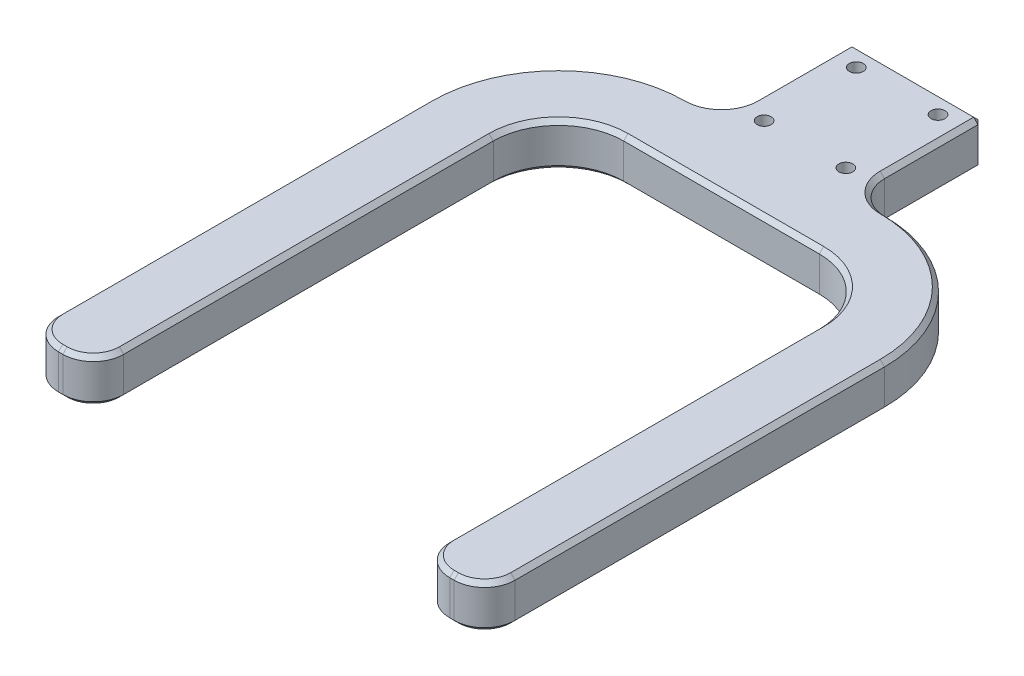
from build123d import *

# Parameters (mm, degrees)
SKETCH1_R           = 1.6
BOSS_EXTRUDE1_DEPTH = 10
FILLET1_R           = 7.5
CHAMFER1_SIZE       = 1


with BuildPart() as part:
    # Sketch1 → Boss-Extrude1 (new body)
    with BuildSketch(Plane(origin=(0, 0, 0), x_dir=(1, 0, 0), z_dir=(0, 1, 0))):
        with BuildLine():
            Line((22.5, 57.5), (0, 57.5))
            Line((0, 57.5), (0, 102.5))
            Line((0, 102.5), (15, 102.5))
            Line((15, 102.5), (15, 72.5))
            Line((15, 72.5), (22.5, 72.5))
            ThreePointArc((22.5, 72.5), (43.713203436, 63.713203436), (52.5, 42.5))
            Line((52.5, 42.5), (52.5, -42.5))
            ThreePointArc((52.5, -42.5), (50.449747468, -47.449747468), (45.5, -49.5))
            Line((45.5, -49.5), (44.5, -49.5))
            ThreePointArc((44.5, -49.5), (39.550252532, -47.449747468), (37.5, -42.5))
            Line((37.5, -42.5), (37.5, 42.5))
            ThreePointArc((37.5, 42.5), (33.106601718, 53.106601718), (22.5, 57.5))
        make_face()
        with Locations(Location((9.4, 97.9, 0), (0, 0, 270))):
            Circle(SKETCH1_R, mode=Mode.SUBTRACT)
        with Locations(Location((9.4, 76.7, 0), (0, 0, 270))):
            Circle(SKETCH1_R, mode=Mode.SUBTRACT)
    extrude(amount=BOSS_EXTRUDE1_DEPTH)

    # Fillet1
    fillet1_edges = [part.edges().sort_by_distance(p)[0] for p in [
        (15, 5, -72.5),
    ]]
    fillet(fillet1_edges, radius=FILLET1_R - 0.0001)  # a hair under: the kernel refuses the full size

    # Chamfer1
    chamfer1_edges = [part.edges().sort_by_distance(p)[0] for p in [
        (7.5, 0, -102.5),
        (33.106601718, 10, -53.106601718),
        (43.713203436, 0, -63.713203436),
        (52.5, 0, 0),
        (50.449747468, 0, 47.449747468),
        (45, 0, 49.5),
        (39.550252532, 0, 47.449747468),
        (37.5, 0, 0),
        (33.106601718, 0, -53.106601718),
        (11.25, 0, -57.5),
        (37.5, 10, 0),
        (15, 5, -102.5),
        (39.550252532, 10, 47.449747468),
        (45, 10, 49.5),
        (50.449747468, 10, 47.449747468),
        (52.5, 10, 0),
        (43.713203436, 10, -63.713203436),
        (15, 0, -91.24995),
        (15, 10, -91.24995),
        (17.196669852, 0, -74.696669852),
        (17.196669852, 10, -74.696669852),
        (7.5, 10, -102.5),
        (11.25, 10, -57.5),
    ]]
    chamfer(chamfer1_edges, length=CHAMFER1_SIZE)

    # Mirror1: part across plane


with BuildPart() as part_1:
    add(part.part)
    add(part.part.mirror(Plane(origin=(0, 10, -57.5), x_dir=(0, 0, 1), z_dir=(1, 0, 0))))


solid = part_1.part
